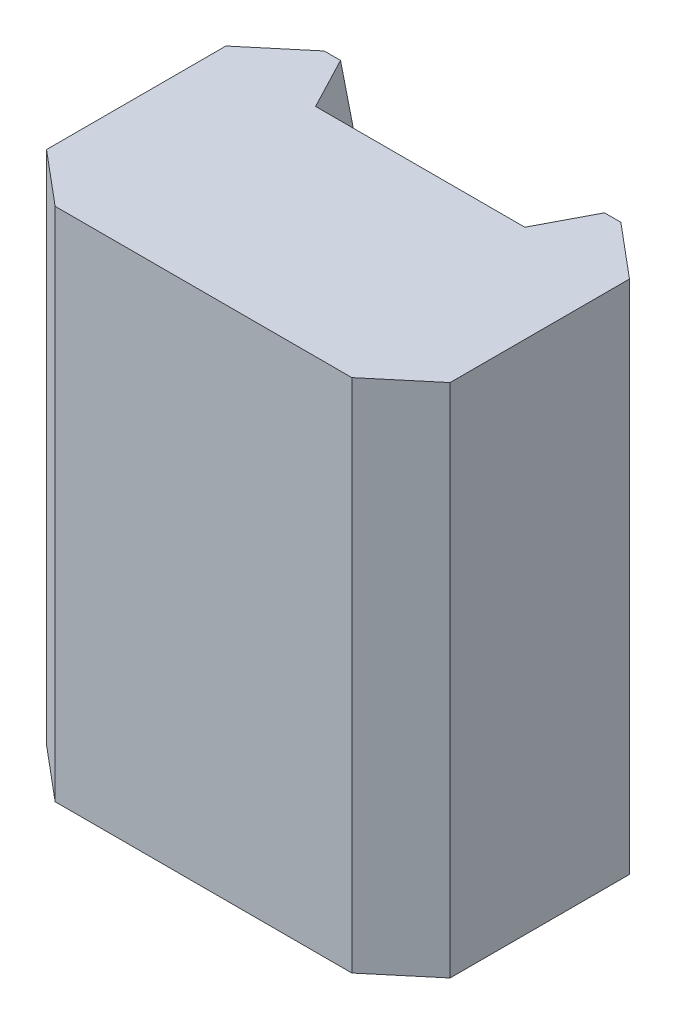
from build123d import *
from OCP.BRepFilletAPI import BRepFilletAPI_MakeChamfer

# Parameters (mm, degrees)
ESQUISSE1_W             = 270
ESQUISSE1_H             = 180
BOSS_EXTRU_1_DEPTH      = 345
CHANFREIN1_SIZE         = 30
CHANFREIN1_SIZE2        = 35.752607778
ENL_V_MAT_EXTRU_1_DEPTH = 90
CHANFREIN2_SIZE         = 20
CHANFREIN2_SIZE_2       = 34.641016151


with BuildPart() as part:
    # Esquisse1 → Boss.-Extru.1 (new body)
    with BuildSketch(Plane(origin=(0, 0, 0), x_dir=(1, 0, 0), z_dir=(0, 1, 0))):
        Rectangle(ESQUISSE1_W, ESQUISSE1_H)
    extrude(amount=BOSS_EXTRU_1_DEPTH)

    # Chanfrein1: one chamfer whose edges measure the first distance from different faces: ONE call of the kernel's chamfer builder (chamfer() names one face for all edges)
    chanfrein1_edges_1 = [part.edges().sort_by_distance(p)[0] for p in [
        (135, 172.5, 90),
        (135, 172.5, -90),
    ]]
    chanfrein1_side_1 = [part.faces().sort_by_distance(p)[0] for p in [
        (135, 172.5, 0),
    ]]
    chanfrein1_edges_2 = [part.edges().sort_by_distance(p)[0] for p in [
        (-135, 172.5, 90),
        (-135, 172.5, -90),
    ]]
    chanfrein1_side_2 = [part.faces().sort_by_distance(p)[0] for p in [
        (-135, 172.5, 0),
    ]]
    chanfrein1 = BRepFilletAPI_MakeChamfer(part.part.solid().wrapped)
    for e in chanfrein1_edges_1:
        chanfrein1.Add(CHANFREIN1_SIZE, CHANFREIN1_SIZE2, e.wrapped, chanfrein1_side_1[0].wrapped)  # the first distance lies on this face
    for e in chanfrein1_edges_2:
        chanfrein1.Add(CHANFREIN1_SIZE, CHANFREIN1_SIZE2, e.wrapped, chanfrein1_side_2[0].wrapped)  # the first distance lies on this face
    add(Compound.cast(chanfrein1.Shape()), mode=Mode.REPLACE)

    # Esquisse2 → Enlèv. mat.-Extru.1 (cut, symmetric)
    with BuildSketch(Plane(origin=(0, 0, 0), x_dir=(0, 0, -1), z_dir=(1, 0, 0))):
        Polygon((55, 345), (255, 345), (255, -83.901384102), align=None)
    extrude(amount=ENL_V_MAT_EXTRU_1_DEPTH, both=True, mode=Mode.SUBTRACT)

    # Chanfrein2
    # the kernel refuses this chamfer: 34.641016151, 20 mm, written as the material it adds along each edge
    with BuildSketch(Plane(origin=(90, 188.719606983, -127.874744083), x_dir=(-0.9983227437537926, -0.02446700349407226, 0.05246965831716883), z_dir=(0, 0.9063077870366479, 0.422618261740704))) as chanfrein2_piece_1_section:
        Polygon((CHANFREIN2_SIZE * 0.998322743754, -CHANFREIN2_SIZE * 0.0578938624027), (-CHANFREIN2_SIZE_2 * 0.0578938624033, -CHANFREIN2_SIZE_2 * 0.998322743765), (0, 0), align=None)
    chanfrein2_piece_1 = extrude(amount=262.055614234, mode=Mode.PRIVATE)
    chanfrein2_piece_1 = split(chanfrein2_piece_1, bisect_by=Plane(origin=(82.381838985, 345, -77.051948242), z_dir=(0, -1, 0)), keep=Keep.TOP, mode=Mode.PRIVATE)
    chanfrein2_piece_1 = split(chanfrein2_piece_1, bisect_by=Plane(origin=(82.381838985, 317.232813397, -90), z_dir=(0, 0, 1)), keep=Keep.TOP, mode=Mode.PRIVATE)
    add(chanfrein2_piece_1)
    with BuildSketch(Plane(origin=(-90, 188.719606983, -127.874744083), x_dir=(-0.0193267656127005, 0.42253932536473243, -0.906138507432097), z_dir=(0, 0.9063077870366479, 0.422618261740704))) as chanfrein2_piece_2_section:
        Polygon((CHANFREIN2_SIZE_2 * 0.999813220633, -CHANFREIN2_SIZE_2 * 0.0193267656129), (-CHANFREIN2_SIZE * 0.0193267656127, -CHANFREIN2_SIZE * 0.999813220622), (0, 0), align=None)
    chanfrein2_piece_2 = extrude(amount=262.055614234, mode=Mode.PRIVATE)
    chanfrein2_piece_2 = split(chanfrein2_piece_2, bisect_by=Plane(origin=(-82.381838985, 345, -77.051948242), z_dir=(0, -1, 0)), keep=Keep.TOP, mode=Mode.PRIVATE)
    chanfrein2_piece_2 = split(chanfrein2_piece_2, bisect_by=Plane(origin=(-82.381838985, 317.232813397, -90), z_dir=(0, 0, 1)), keep=Keep.TOP, mode=Mode.PRIVATE)
    add(chanfrein2_piece_2)


solid = part.part
